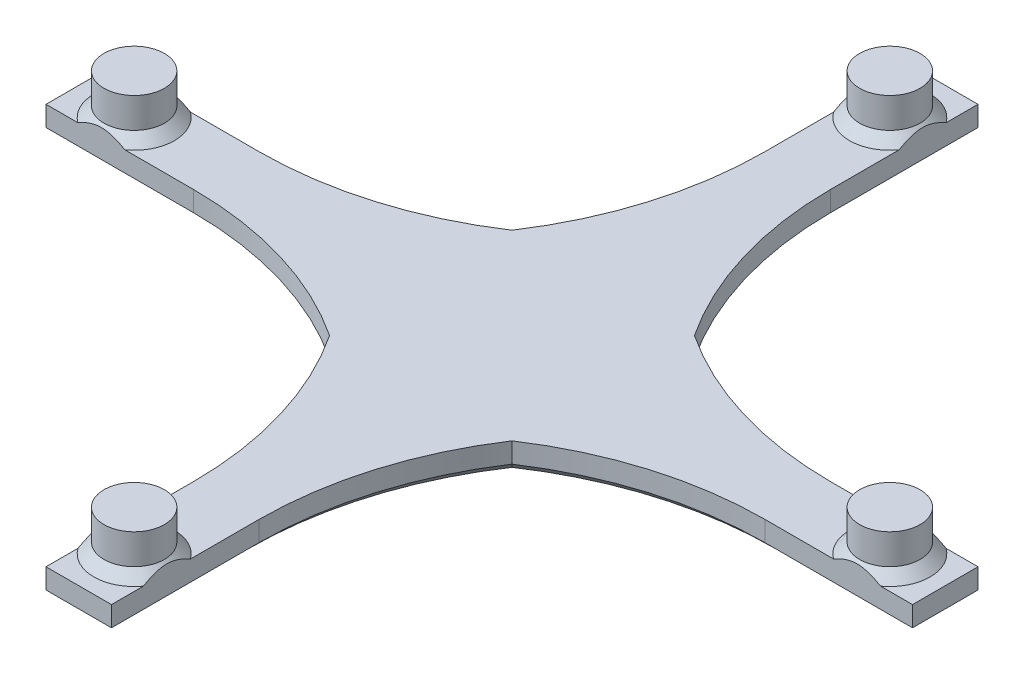
from build123d import *

# Parameters (mm, degrees)
SKETCH1_R           = 3
BOSS_EXTRUDE1_DEPTH = 4
BOSS_EXTRUDE2_DEPTH = 3
SKETCH3_R           = 3
BOSS_EXTRUDE3_DEPTH = 4
FILLET2_R           = 35
CHAMFER1_SIZE       = 1
CHAMFER2_SIZE       = 1


with BuildPart() as part:
    # Sketch1 → Boss-Extrude1 (new body)
    with BuildSketch(Plane(origin=(0, 0, 0), x_dir=(1, 0, 0), z_dir=(0, 1, 0))):
        with Locations(Location((0, 0, 0), (0, 0, 270))):
            Circle(SKETCH1_R)
    extrude(amount=-BOSS_EXTRUDE1_DEPTH)

    # Sketch2 → Boss-Extrude2 (add)
    with BuildSketch(Plane(origin=(0, 0, 0), x_dir=(1, 0, 0), z_dir=(0, 1, 0))):
        Polygon((-3.25, 43), (-3.25, 13.856601718), (-13.856601718, 3.25), (-43, 3.25), (-43, -3.25), (-13.856601718, -3.25), (-3.25, -13.856601718), (-3.25, -43), (3.25, -43), (3.25, -13.856601718), (13.856601718, -3.25), (43, -3.25), (43, 3.25), (13.856601718, 3.25), (3.25, 13.856601718), (3.25, 43), align=None)
    extrude(amount=BOSS_EXTRUDE2_DEPTH)

    # Sketch3 → Boss-Extrude3 (add)
    with BuildSketch(Plane(origin=(0, 3, 0), x_dir=(1, 0, 0), z_dir=(0, 1, 0))):
        with Locations(Location((-37.5, 0, 0), (0, 0, 270))):
            Circle(SKETCH3_R)
        with Locations(Location((0, 37.5, 0), (0, 0, 270))):
            Circle(SKETCH3_R)
        with Locations(Location((37.5, 0, 0), (0, 0, 270))):
            Circle(SKETCH3_R)
        with Locations(Location((0, -37.5, 0), (0, 0, 270))):
            Circle(SKETCH3_R)
    extrude(amount=BOSS_EXTRUDE3_DEPTH)

    # Fillet2
    # the kernel refuses this fillet: 35 mm, written as the material it adds along each edge
    with BuildSketch(Plane(origin=(-13.856601718, 0, -3.25), x_dir=(0.7071067811865472, 0, -0.7071067811865478), z_dir=(0, 1, 0)), Plane(origin=(-3.25, 0, -13.856601718), x_dir=(0, 0, -1), z_dir=(0, 1, 0)), Plane(origin=(-13.856601718, 0, 3.25), x_dir=(-1, 0, 0), z_dir=(0, 1, 0)), Plane(origin=(-3.25, 0, 13.856601718), x_dir=(-0.7071067811865476, 0, -0.7071067811865475), z_dir=(0, 1, 0))) as fillet2_piece_1:
        with BuildLine():
            CenterArc((FILLET2_R * 0.414213562373, FILLET2_R), FILLET2_R, 225, 45)
            Line((-FILLET2_R * 0.292893218813, FILLET2_R * 0.292893218813), (0, 0))
            Line((0, 0), (FILLET2_R * 0.414213562373, 0))
        make_face()
    extrude(amount=3)
    with BuildSketch(Plane(origin=(3.25, 0, -13.856601718), x_dir=(0, 0, -1), z_dir=(0, 1, 0)), Plane(origin=(13.856601718, 0, -3.25), x_dir=(-0.7071067811865475, 0, -0.7071067811865476), z_dir=(0, 1, 0)), Plane(origin=(13.856601718, 0, 3.25), x_dir=(1, 0, 0), z_dir=(0, 1, 0)), Plane(origin=(3.25, 0, 13.856601718), x_dir=(0.7071067811865477, 0, -0.7071067811865474), z_dir=(0, 1, 0))) as fillet2_piece_2:
        with BuildLine():
            CenterArc((FILLET2_R * 0.414213562373, -FILLET2_R), FILLET2_R, 90, 45)
            Line((-FILLET2_R * 0.292893218813, -FILLET2_R * 0.292893218813), (0, 0))
            Line((0, 0), (FILLET2_R * 0.414213562373, 0))
        make_face()
    extrude(amount=3)

    # Chamfer1
    # the kernel refuses this chamfer: 1 mm, written as the material it adds along each edge
    with BuildSketch(Plane(origin=(-37.5, 3, 0), x_dir=(0, 0, 1), z_dir=(-1, 0, 0))) as chamfer1_piece_1_section:
        Polygon((3 + CHAMFER1_SIZE, 0), (3, CHAMFER1_SIZE), (3, 0), align=None)
    chamfer1_piece_1 = revolve(axis=Axis((-37.5, 3, 0), (0, 1, 0)), mode=Mode.PRIVATE)
    chamfer1_piece_1 = split(chamfer1_piece_1, bisect_by=Plane(origin=(-34.177083345, 3.132594622, 3.25), z_dir=(0, 0, -1)), keep=Keep.TOP, mode=Mode.PRIVATE)
    chamfer1_piece_1 = split(chamfer1_piece_1, bisect_by=Plane(origin=(-34.177083345, 3.132594622, -3.25), z_dir=(0, 0, 1)), keep=Keep.TOP, mode=Mode.PRIVATE)
    add(chamfer1_piece_1)
    with BuildSketch(Plane(origin=(0, 3, -37.5), x_dir=(0, 0, 1), z_dir=(-1, 0, 0))) as chamfer1_piece_2_section:
        Polygon((3 + CHAMFER1_SIZE, 0), (3, CHAMFER1_SIZE), (3, 0), align=None)
    chamfer1_piece_2 = revolve(axis=Axis((0, 3, -37.5), (0, 1, 0)), mode=Mode.PRIVATE)
    chamfer1_piece_2 = split(chamfer1_piece_2, bisect_by=Plane(origin=(-3.25, 3.484784137, -40.984784137), z_dir=(1, 0, 0)), keep=Keep.TOP, mode=Mode.PRIVATE)
    chamfer1_piece_2 = split(chamfer1_piece_2, bisect_by=Plane(origin=(3.25, 3.484784137, -40.984784137), z_dir=(-1, 0, 0)), keep=Keep.TOP, mode=Mode.PRIVATE)
    add(chamfer1_piece_2)
    with BuildSketch(Plane(origin=(37.5, 3, 0), x_dir=(0, 0, 1), z_dir=(-1, 0, 0))) as chamfer1_piece_3_section:
        Polygon((3 + CHAMFER1_SIZE, 0), (3, CHAMFER1_SIZE), (3, 0), align=None)
    chamfer1_piece_3 = revolve(axis=Axis((37.5, 3, 0), (0, 1, 0)), mode=Mode.PRIVATE)
    chamfer1_piece_3 = split(chamfer1_piece_3, bisect_by=Plane(origin=(40.822916655, 3.132594622, -3.25), z_dir=(0, 0, 1)), keep=Keep.TOP, mode=Mode.PRIVATE)
    chamfer1_piece_3 = split(chamfer1_piece_3, bisect_by=Plane(origin=(40.822916655, 3.132594622, 3.25), z_dir=(0, 0, -1)), keep=Keep.TOP, mode=Mode.PRIVATE)
    add(chamfer1_piece_3)
    with BuildSketch(Plane(origin=(0, 3, 37.5), x_dir=(0, 0, 1), z_dir=(-1, 0, 0))) as chamfer1_piece_4_section:
        Polygon((3 + CHAMFER1_SIZE, 0), (3, CHAMFER1_SIZE), (3, 0), align=None)
    chamfer1_piece_4 = revolve(axis=Axis((0, 3, 37.5), (0, 1, 0)), mode=Mode.PRIVATE)
    chamfer1_piece_4 = split(chamfer1_piece_4, bisect_by=Plane(origin=(3.25, 3.484784137, 34.015215863), z_dir=(-1, 0, 0)), keep=Keep.TOP, mode=Mode.PRIVATE)
    chamfer1_piece_4 = split(chamfer1_piece_4, bisect_by=Plane(origin=(-3.25, 3.484784137, 34.015215863), z_dir=(1, 0, 0)), keep=Keep.TOP, mode=Mode.PRIVATE)
    add(chamfer1_piece_4)

    # Chamfer2
    chamfer2_edges = [part.edges().sort_by_distance(p)[0] for p in [
        (-3.25, 0, 35.6770382),
        (3.25, 0, 35.6770382),
        (0, 0, 43),
        (3.25, 0, -35.6770382),
        (-3.25, 0, -35.6770382),
        (-4.732121832, 0, -18.276782958),
        (-18.276782958, 0, -4.732121832),
        (-35.6770382, 0, -3.25),
        (-35.6770382, 0, 3.25),
        (-18.276782958, 0, 4.732121832),
        (-4.732121832, 0, 18.276782958),
        (4.732121832, 0, 18.276782958),
        (18.276782958, 0, 4.732121832),
        (35.6770382, 0, 3.25),
        (35.6770382, 0, -3.25),
        (18.276782958, 0, -4.732121832),
        (4.732121832, 0, -18.276782958),
        (43, 0, 0),
        (-43, 0, 0),
        (0, 0, -43),
    ]]
    chamfer(chamfer2_edges, length=CHAMFER2_SIZE)


solid = part.part
